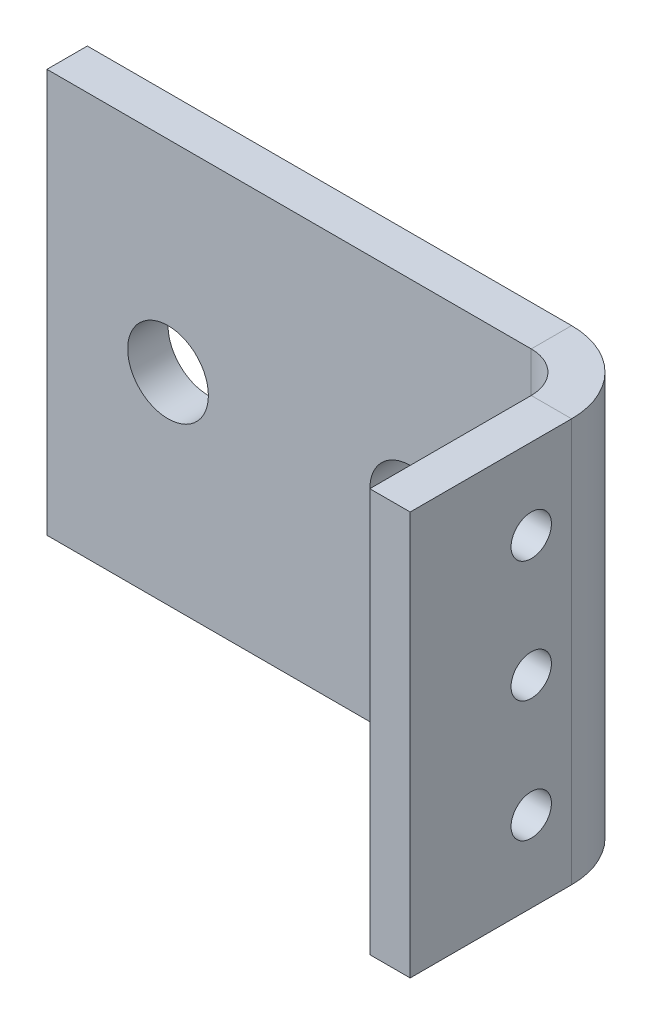
from build123d import *

# Parameters (mm, degrees)
SKETCH1_W           = 60
SKETCH1_H           = 50
BASE_FLANGE1_DEPTH  = 5
SKETCH6_R           = 5
CUT_EXTRUDE1_DEPTH  = 66.192024052
EDGE_FLANGE1_DEPTH  = 50
HOLE1_START         = 5
HOLE1_OUTLINE_R     = 2.5
HOLE1_DEPTH         = 5
LPATTERN1_COUNT     = 2
LPATTERN1_PITCH     = 15
LPATTERN1_COL_COUNT = 2
LPATTERN1_COL_PITCH = 15


# Read off the part's stored shape, not the designer's step: Hole1
# Sheet-metal steps are written as plain solids
with BuildPart() as part:
    # Sketch1 → Base-Flange1 (new body)
    with BuildSketch(Plane.XY):
        with Locations((-30, 0)):
            Rectangle(SKETCH1_W, SKETCH1_H)
    extrude(amount=-BASE_FLANGE1_DEPTH)

    # Sketch6 → Cut-Extrude1 (cut, through all)
    with BuildSketch(Plane.XY):
        with Locations((-45, 0)):
            Circle(SKETCH6_R)
        with Locations((-15, 0)):
            Circle(SKETCH6_R)
    extrude(amount=-CUT_EXTRUDE1_DEPTH, mode=Mode.SUBTRACT)

    # Edge-Flange1 section (across the edge) → Edge-Flange1 (add)
    with BuildSketch(Plane(origin=(5, -25, 0), x_dir=(-1, 0, 0), z_dir=(0, 1, 0))):
        with BuildLine():
            Line((-5, 5), (-5, 25))
            Line((-5, 25), (0, 25))
            Line((0, 25), (0, 5))
            ThreePointArc((0, 5), (1.464466094, 1.464466094), (5, 0))
            Line((5, 0), (5, -5))
            ThreePointArc((5, -5), (-2.071067812, -2.071067812), (-5, 5))
        make_face()
    extrude(amount=EDGE_FLANGE1_DEPTH)

    # Hole1 outline → Hole1 (cut)
    with BuildSketch(Plane.YZ.offset(HOLE1_START)):
        with Locations((0, 10)):
            Circle(HOLE1_OUTLINE_R)
    hole1 = extrude(amount=HOLE1_DEPTH, mode=Mode.SUBTRACT)

    # LPattern1: Hole1 ×2
    with Locations(*[(0, i * LPATTERN1_PITCH, 0) for i in range(1, LPATTERN1_COUNT)]):
        add(hole1, mode=Mode.SUBTRACT)

    # LPattern1 col: Hole1 ×2
    with Locations(*[(0, -i * LPATTERN1_COL_PITCH, 0) for i in range(1, LPATTERN1_COL_COUNT)]):
        add(hole1, mode=Mode.SUBTRACT)


solid = part.part
